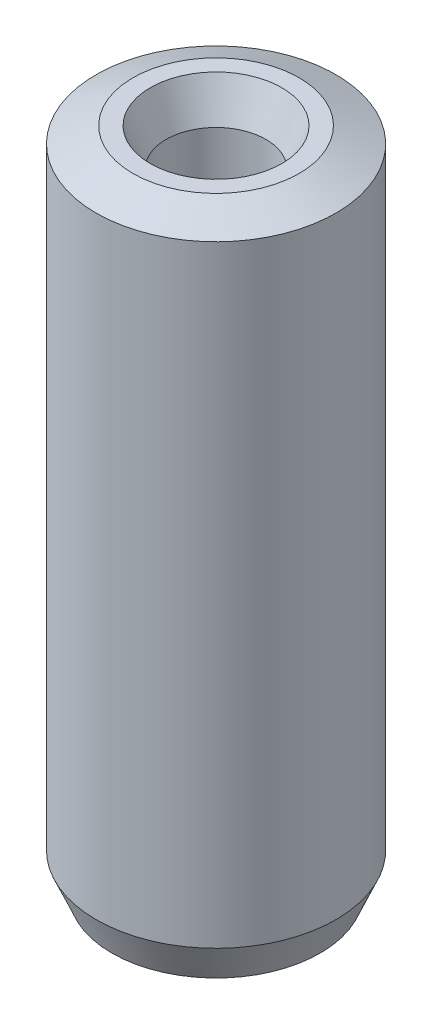
from build123d import *
from OCP.BRepFilletAPI import BRepFilletAPI_MakeChamfer

# Parameters (mm, degrees)
SKETCH1_R           = 5
BOSS_EXTRUDE1_DEPTH = 27.706468219
SKETCH2_R           = 2.083552606
CUT_EXTRUDE1_DEPTH  = 29.594551599
CHAMFER1_SIZE       = 0.658149221
CHAMFER1_SIZE2      = 1.5387154


with BuildPart() as part:
    # Sketch1 → Boss-Extrude1 (new body)
    with BuildSketch(Plane(origin=(0, 0, 0), x_dir=(1, 0, 0), z_dir=(0, 1, 0))):
        Circle(SKETCH1_R)
    extrude(amount=BOSS_EXTRUDE1_DEPTH)

    # Sketch2 → Cut-Extrude1 (cut, through all)
    with BuildSketch(Plane(origin=(0, 0, 0), x_dir=(1, 0, 0), z_dir=(0, 1, 0))):
        Circle(SKETCH2_R)
    extrude(amount=CUT_EXTRUDE1_DEPTH, mode=Mode.SUBTRACT)

    # Chamfer1: one chamfer whose edges measure the first distance from different faces: ONE call of the kernel's chamfer builder (chamfer() names one face for all edges)
    chamfer1_edges_1 = [part.edges().sort_by_distance(p)[0] for p in [
        (-2.083552606, 27.706468219, 0),
    ]]
    chamfer1_side_1 = [part.faces().sort_by_distance(p)[0] for p in [
        (-4.858578644, 27.706468219, 0),
    ]]
    chamfer1_edges_2 = [part.edges().sort_by_distance(p)[0] for p in [
        (-2.083552606, 0, 0),
    ]]
    chamfer1_side_2 = [part.faces().sort_by_distance(p)[0] for p in [
        (-2.083552606, 13.853234109, 0),
    ]]
    chamfer1_edges_3 = [part.edges().sort_by_distance(p)[0] for p in [
        (-5, 0, 0),
    ]]
    chamfer1_side_3 = [part.faces().sort_by_distance(p)[0] for p in [
        (-4.858578644, 0, 0),
    ]]
    chamfer1_edges_4 = [part.edges().sort_by_distance(p)[0] for p in [
        (-5, 27.706468219, 0),
    ]]
    chamfer1_side_4 = [part.faces().sort_by_distance(p)[0] for p in [
        (-5, 13.853234109, 0),
    ]]
    chamfer1 = BRepFilletAPI_MakeChamfer(part.part.solid().wrapped)
    for e in chamfer1_edges_1:
        chamfer1.Add(CHAMFER1_SIZE, CHAMFER1_SIZE2, e.wrapped, chamfer1_side_1[0].wrapped)  # the first distance lies on this face
    for e in chamfer1_edges_2:
        chamfer1.Add(CHAMFER1_SIZE, CHAMFER1_SIZE2, e.wrapped, chamfer1_side_2[0].wrapped)  # the first distance lies on this face
    for e in chamfer1_edges_3:
        chamfer1.Add(CHAMFER1_SIZE, CHAMFER1_SIZE2, e.wrapped, chamfer1_side_3[0].wrapped)  # the first distance lies on this face
    for e in chamfer1_edges_4:
        chamfer1.Add(CHAMFER1_SIZE, CHAMFER1_SIZE2, e.wrapped, chamfer1_side_4[0].wrapped)  # the first distance lies on this face
    add(Compound.cast(chamfer1.Shape()), mode=Mode.REPLACE)


solid = part.part
